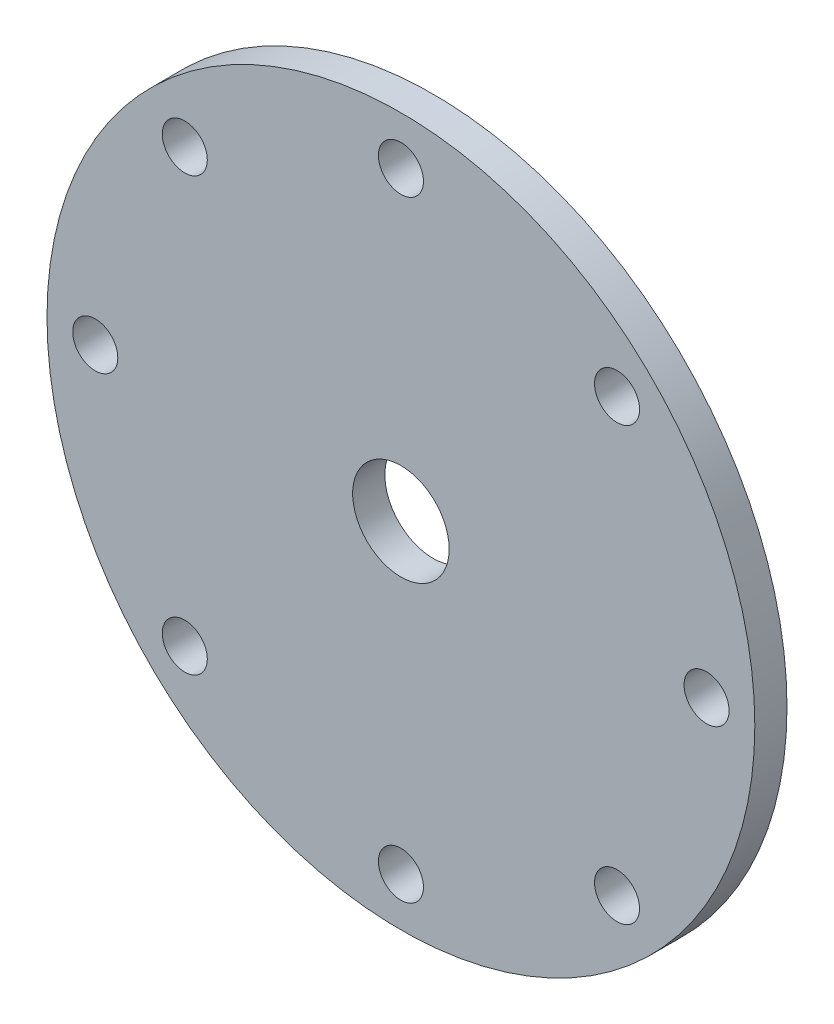
from build123d import *

# Parameters (mm, degrees)
SKETCH1_R           = 55
SKETCH1_R_2         = 3.5
SKETCH1_R_3         = 7.5
BOSS_EXTRUDE2_DEPTH = 5


with BuildPart() as part:
    # Sketch1 → Boss-Extrude2 (new body)
    with BuildSketch(Plane.XY):
        Circle(SKETCH1_R)
        with Locations((-33.587572106, -33.587572106)):
            Circle(SKETCH1_R_2, mode=Mode.SUBTRACT)
        with Locations((-47.5, 0)):
            Circle(SKETCH1_R_2, mode=Mode.SUBTRACT)
        with Locations((0, -47.5)):
            Circle(SKETCH1_R_2, mode=Mode.SUBTRACT)
        with Locations((33.587572106, -33.587572106)):
            Circle(SKETCH1_R_2, mode=Mode.SUBTRACT)
        with Locations((-33.587572106, 33.587572106)):
            Circle(SKETCH1_R_2, mode=Mode.SUBTRACT)
        Circle(SKETCH1_R_3, mode=Mode.SUBTRACT)
        with Locations((47.5, 0)):
            Circle(SKETCH1_R_2, mode=Mode.SUBTRACT)
        with Locations((0, 47.5)):
            Circle(SKETCH1_R_2, mode=Mode.SUBTRACT)
        with Locations((33.587572106, 33.587572106)):
            Circle(SKETCH1_R_2, mode=Mode.SUBTRACT)
    extrude(amount=BOSS_EXTRUDE2_DEPTH)


solid = part.part
